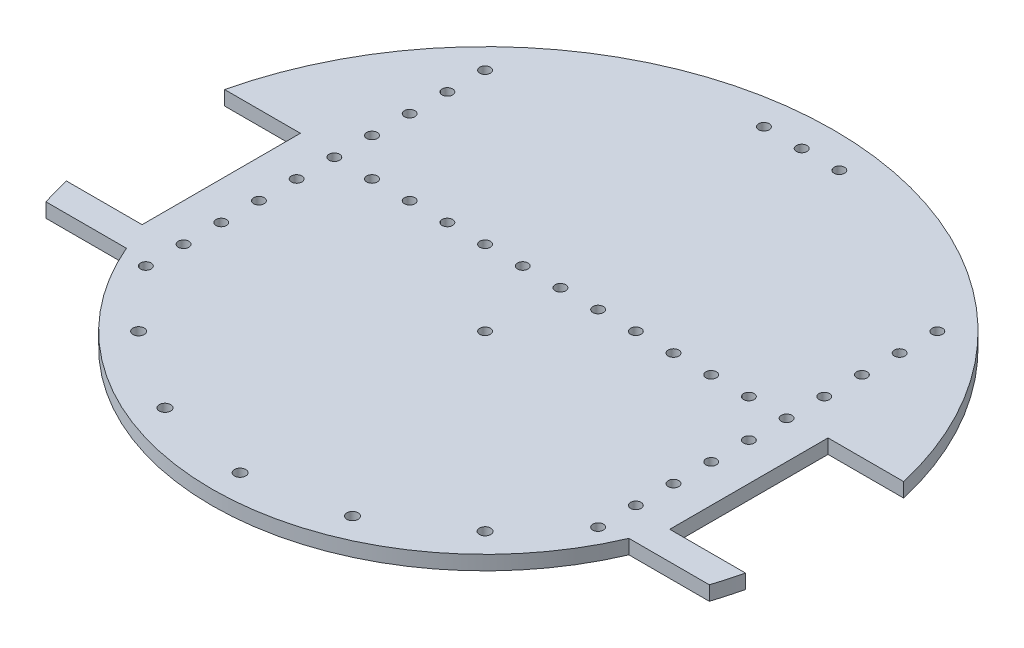
from build123d import *

# Parameters (mm, degrees)
SKETCH1_R           = 117.475
BOSS_EXTRUDE1_DEPTH = 4.826
CUT_EXTRUDE4_DEPTH  = 167.204817999
SKETCH4_R           = 1.778
CUT_EXTRUDE5_DEPTH  = 167.204817999
SKETCH5_R           = 1.778
CUT_EXTRUDE6_DEPTH  = 167.204817999
SKETCH6_R           = 1.778
CUT_EXTRUDE7_DEPTH  = 167.204817999
SKETCH9_R           = 1.905
CUT_EXTRUDE10_DEPTH = 165.051067129
CIRPATTERN1_COUNT   = 3
CIRPATTERN1_ANGLE   = 45
CIRPATTERN2_COUNT   = 3
CIRPATTERN2_ANGLE   = 45


with BuildPart() as part:
    # Sketch1 → Boss-Extrude1 (new body)
    with BuildSketch(Plane(origin=(0, 0, 0), x_dir=(1, 0, 0), z_dir=(0, 1, 0))):
        Circle(SKETCH1_R)
    extrude(amount=-BOSS_EXTRUDE1_DEPTH)

    # Sketch3 → Cut-Extrude4 (cut, through all)
    with BuildSketch(Plane(origin=(0, 0, 0), x_dir=(1, 0, 0), z_dir=(0, 1, 0))):
        with BuildLine():
            Line((-114.407546626, 26.67), (-88.9, 26.67))
            Line((-88.9, 26.67), (-88.9, -26.67))
            Line((-88.9, -26.67), (-114.407546626, -26.67))
            ThreePointArc((-114.407546626, -26.67), (-117.475, 0), (-114.407546626, 26.67))
        make_face()
        with BuildLine():
            Line((0, -92.075), (0, -117.475))
            ThreePointArc((0, -117.475), (-69.095470184, -95.006271504), (-111.76, -36.195))
            Line((-111.76, -36.195), (-84.662433227, -36.195))
            ThreePointArc((-84.662433227, -36.195), (-50.720562891, -76.845495151), (0, -92.075))
        make_face()
    cut_extrude4 = extrude(amount=-CUT_EXTRUDE4_DEPTH, mode=Mode.SUBTRACT)

    # Sketch4 → Cut-Extrude5 (cut, through all)
    with BuildSketch(Plane(origin=(0, 0, 0), x_dir=(1, 0, 0), z_dir=(0, 1, 0))):
        with Locations((-76.2, 0)):
            Circle(SKETCH4_R)
        with Locations((-76.2, 12.7)):
            Circle(SKETCH4_R)
        with Locations((-76.2, 25.4)):
            Circle(SKETCH4_R)
        with Locations((-76.2, 38.1)):
            Circle(SKETCH4_R)
        with Locations((-76.2, -12.7)):
            Circle(SKETCH4_R)
        with Locations((-76.2, -25.4)):
            Circle(SKETCH4_R)
        with Locations((-76.2, -38.1)):
            Circle(SKETCH4_R)
        with Locations((-76.2, 50.8)):
            Circle(SKETCH4_R)
        with Locations((-76.2, 63.5)):
            Circle(SKETCH4_R)
        with Locations((-76.2, 76.2)):
            Circle(SKETCH4_R)
    cut_extrude5 = extrude(amount=-CUT_EXTRUDE5_DEPTH, mode=Mode.SUBTRACT)

    # Sketch5 → Cut-Extrude6 (cut, through all)
    with BuildSketch(Plane(origin=(0, 0, 0), x_dir=(1, 0, 0), z_dir=(0, 1, 0))):
        Circle(SKETCH5_R)
    extrude(amount=-CUT_EXTRUDE6_DEPTH, mode=Mode.SUBTRACT)

    # Sketch6 → Cut-Extrude7 (cut, through all)
    with BuildSketch(Plane(origin=(0, 0, 0), x_dir=(1, 0, 0), z_dir=(0, 1, 0))):
        with Locations((0, 25.4)):
            Circle(SKETCH6_R)
        with Locations((-12.7, 25.4)):
            Circle(SKETCH6_R)
        with Locations((-25.4, 25.4)):
            Circle(SKETCH6_R)
        with Locations((-38.1, 25.4)):
            Circle(SKETCH6_R)
        with Locations((12.7, 25.4)):
            Circle(SKETCH6_R)
        with Locations((25.4, 25.4)):
            Circle(SKETCH6_R)
        with Locations((38.1, 25.4)):
            Circle(SKETCH6_R)
        with Locations((-50.8, 25.4)):
            Circle(SKETCH6_R)
        with Locations((50.8, 25.4)):
            Circle(SKETCH6_R)
        with Locations((-63.5, 25.4)):
            Circle(SKETCH6_R)
        with Locations((63.5, 25.4)):
            Circle(SKETCH6_R)
        with Locations((0, 106.68)):
            Circle(SKETCH6_R)
        with Locations((-12.7, 106.68)):
            Circle(SKETCH6_R)
        with Locations((12.7, 106.68)):
            Circle(SKETCH6_R)
    extrude(amount=-CUT_EXTRUDE7_DEPTH, mode=Mode.SUBTRACT)

    # Mirror1: Cut-Extrude4 across plane
    add(cut_extrude4.mirror(Plane(origin=(0, 0, 0), x_dir=(0, 0, 1), z_dir=(1, 0, 0))), mode=Mode.SUBTRACT)

    # Mirror3: Cut-Extrude5 across plane
    add(cut_extrude5.mirror(Plane(origin=(0, 0, 0), x_dir=(0, 0, 1), z_dir=(1, 0, 0))), mode=Mode.SUBTRACT)

    # Sketch9 → Cut-Extrude10 (cut, through all)
    with BuildSketch(Plane(origin=(0, 0, 0), x_dir=(1, 0, 0), z_dir=(0, 1, 0))):
        with Locations((0, -82.55)):
            Circle(SKETCH9_R)
    cut_extrude10 = extrude(amount=-CUT_EXTRUDE10_DEPTH, mode=Mode.SUBTRACT)

    # CirPattern1: Cut-Extrude10 ×3 about axis
    cirpattern1_axis = Axis((0, -4.826, 0), (0, 1, 0))
    for i in range(1, CIRPATTERN1_COUNT):
        add(cut_extrude10.rotate(cirpattern1_axis, i * CIRPATTERN1_ANGLE / (CIRPATTERN1_COUNT - 1)), mode=Mode.SUBTRACT)

    # CirPattern2: Cut-Extrude10 ×3 about axis
    cirpattern2_axis = Axis((0, -4.826, 0), (0, -1, 0))
    for i in range(1, CIRPATTERN2_COUNT):
        add(cut_extrude10.rotate(cirpattern2_axis, i * CIRPATTERN2_ANGLE / (CIRPATTERN2_COUNT - 1)), mode=Mode.SUBTRACT)


solid = part.part
